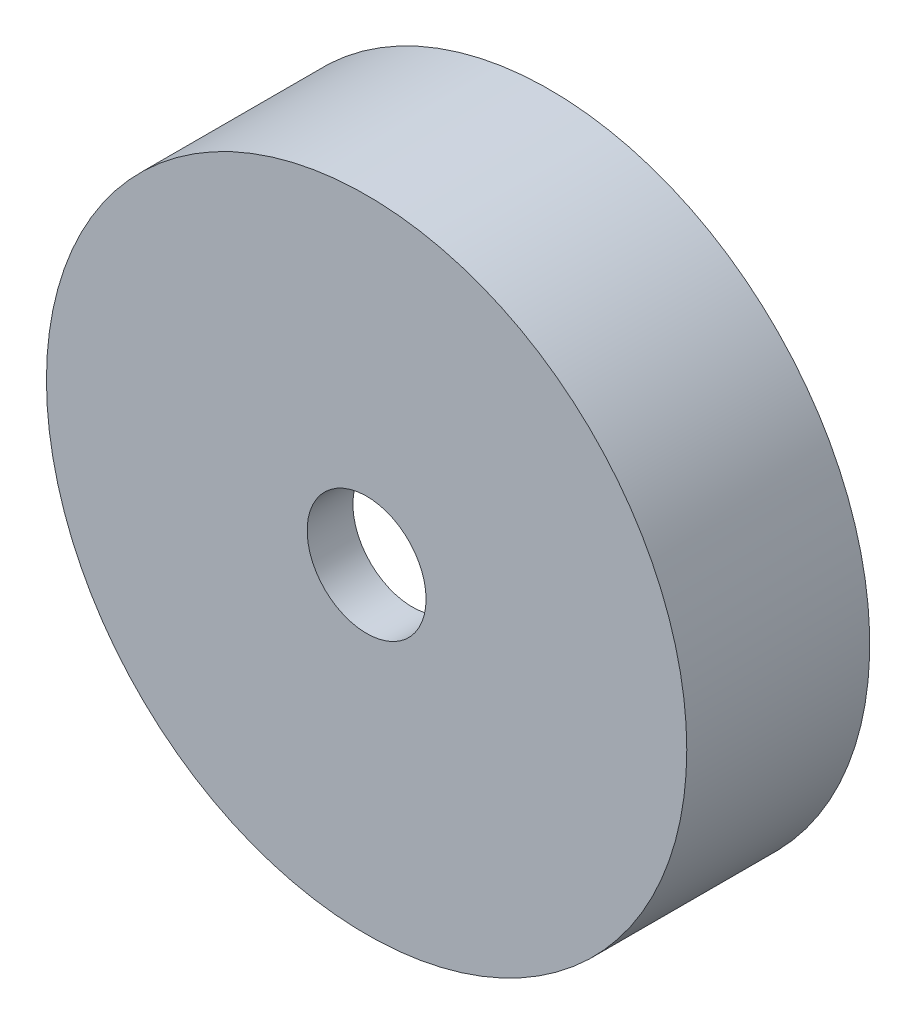
from build123d import *

# Parameters (mm, degrees)
SKETCH_2_R          = 35
SKETCH_2_R_2        = 6.5
EXTRUDE_1_DEPTH     = 5
EXTRUDE_START       = 15
SKETCH_3_R          = 35
SKETCH_3_R_2        = 30
EXTRUDE_2_DEPTH     = 15
SKETCH_4_R          = 1.55
CUT_EXTRUDE_1_DEPTH = 10
CUT_EXTRUDE_5_DEPTH = 15
FILLET_1_R          = 1
EXTRUDE_START_2     = 3
SKETCH_10_R         = 30
SKETCH_10_R_2       = 29.3
EXTRUDE_3_DEPTH     = 3


with BuildPart() as part:
    # 草图2 → 凸台-拉伸1 (new body)
    with BuildSketch(Plane.XY):
        Circle(SKETCH_2_R)
        Circle(SKETCH_2_R_2, mode=Mode.SUBTRACT)
    extrude(amount=EXTRUDE_1_DEPTH)

    # 草图3 → 凸台-拉伸2 (add)
    with BuildSketch(Plane(origin=(0, 0, 0), x_dir=(-1, 0, 0), z_dir=(0, 0, -1)).offset(EXTRUDE_START)):
        Circle(SKETCH_3_R)
        Circle(SKETCH_3_R_2, mode=Mode.SUBTRACT)
    extrude(amount=-EXTRUDE_2_DEPTH)

    # 草图4 → 切除-拉伸1 (cut)
    with BuildSketch(Plane(origin=(0, 0, -15), x_dir=(-1, 0, 0), z_dir=(0, 0, -1))):
        with Locations((0, 32.5)):
            Circle(SKETCH_4_R)
        with Locations((32.5, 0)):
            Circle(SKETCH_4_R)
        with Locations((0, -32.5)):
            Circle(SKETCH_4_R)
        with Locations((-32.5, 0)):
            Circle(SKETCH_4_R)
    extrude(amount=-CUT_EXTRUDE_1_DEPTH, mode=Mode.SUBTRACT)

    # 草图9 → 切除-拉伸5 (cut)
    with BuildSketch(Plane(origin=(0, 0, -15), x_dir=(-1, 0, 0), z_dir=(0, 0, -1))):
        with BuildLine():
            ThreePointArc((-21.942558771, 20.457861926), (-21.955665556, 21.955665556), (-20.457861926, 21.942558771))
            ThreePointArc((-20.457861926, 21.942558771), (-21.213203436, 21.213203436), (-21.942558771, 20.457861926))
        make_face()
        with BuildLine():
            ThreePointArc((20.457861926, 21.942558771), (21.955665556, 21.955665556), (21.942558771, 20.457861926))
            ThreePointArc((21.942558771, 20.457861926), (21.213203436, 21.213203436), (20.457861926, 21.942558771))
        make_face()
        with BuildLine():
            ThreePointArc((21.942558771, -20.457861926), (21.955665556, -21.955665556), (20.457861926, -21.942558771))
            ThreePointArc((20.457861926, -21.942558771), (21.213203436, -21.213203436), (21.942558771, -20.457861926))
        make_face()
        with BuildLine():
            ThreePointArc((-20.457861926, -21.942558771), (-21.955665556, -21.955665556), (-21.942558771, -20.457861926))
            ThreePointArc((-21.942558771, -20.457861926), (-21.213203436, -21.213203436), (-20.457861926, -21.942558771))
        make_face()
    extrude(amount=-CUT_EXTRUDE_5_DEPTH, mode=Mode.SUBTRACT)

    # 圆角1
    # the kernel refuses this fillet: 1 mm, written as the material it takes off along each edge
    with BuildSketch(Plane(origin=(0, 0, -15), x_dir=(-0.740463861633537, 0.6720961758667804, 0), z_dir=(-0.6720961758667804, -0.740463861633537, 0))) as fillet_1_piece_1:
        with BuildLine():
            CenterArc((30 + FILLET_1_R, -FILLET_1_R), FILLET_1_R, 90, 90)
            Line((30, -FILLET_1_R), (30, 0))
            Line((30, 0), (30 + FILLET_1_R, 0))
        make_face()
    revolve(axis=Axis((0, 0, -15), (0, 0, -1)), revolution_arc=95.541888931, mode=Mode.SUBTRACT)
    with BuildSketch(Plane(origin=(0, 0, -15), x_dir=(0.6720961758667806, 0.7404638616335367, 0), z_dir=(-0.7404638616335367, 0.6720961758667806, 0))) as fillet_1_piece_2:
        with BuildLine():
            CenterArc((30 + FILLET_1_R, -FILLET_1_R), FILLET_1_R, 90, 90)
            Line((30, -FILLET_1_R), (30, 0))
            Line((30, 0), (30 + FILLET_1_R, 0))
        make_face()
    revolve(axis=Axis((0, 0, -15), (0, 0, -1)), revolution_arc=95.541888931, mode=Mode.SUBTRACT)
    with BuildSketch(Plane(origin=(0, 0, -15), x_dir=(0.7404638616335368, -0.6720961758667805, 0), z_dir=(0.6720961758667805, 0.7404638616335368, 0))) as fillet_1_piece_3:
        with BuildLine():
            CenterArc((30 + FILLET_1_R, -FILLET_1_R), FILLET_1_R, 90, 90)
            Line((30, -FILLET_1_R), (30, 0))
            Line((30, 0), (30 + FILLET_1_R, 0))
        make_face()
    revolve(axis=Axis((0, 0, -15), (0, 0, -1)), revolution_arc=95.541888931, mode=Mode.SUBTRACT)
    with BuildSketch(Plane(origin=(0, 0, -15), x_dir=(-1, 0, 0), z_dir=(0, -1, 0))) as fillet_1_piece_4:
        with BuildLine():
            CenterArc((30 + FILLET_1_R, -FILLET_1_R), FILLET_1_R, 90, 90)
            Line((30, -FILLET_1_R), (30, 0))
            Line((30, 0), (30 + FILLET_1_R, 0))
        make_face()
    revolve(axis=Axis((0, 0, -15), (0, 0, -1)), revolution_arc=47.769631262, mode=Mode.SUBTRACT)
    with BuildSketch(Plane(origin=(0, 0, -15), x_dir=(-0.6721131469252694, -0.7404484571732264, 0), z_dir=(0.7404484571732264, -0.6721131469252694, 0))) as fillet_1_piece_5:
        with BuildLine():
            CenterArc((30 + FILLET_1_R, -FILLET_1_R), FILLET_1_R, 90, 90)
            Line((30, -FILLET_1_R), (30, 0))
            Line((30, 0), (30 + FILLET_1_R, 0))
        make_face()
    revolve(axis=Axis((0, 0, -15), (0, 0, -1)), revolution_arc=47.769631262, mode=Mode.SUBTRACT)

    # 草图10 → 凸台-拉伸3 (add)
    with BuildSketch(Plane(origin=(0, 0, 0), x_dir=(-1, 0, 0), z_dir=(0, 0, -1)).offset(EXTRUDE_START_2)):
        Circle(SKETCH_10_R)
        Circle(SKETCH_10_R_2, mode=Mode.SUBTRACT)
    extrude(amount=-EXTRUDE_3_DEPTH)


solid = part.part
